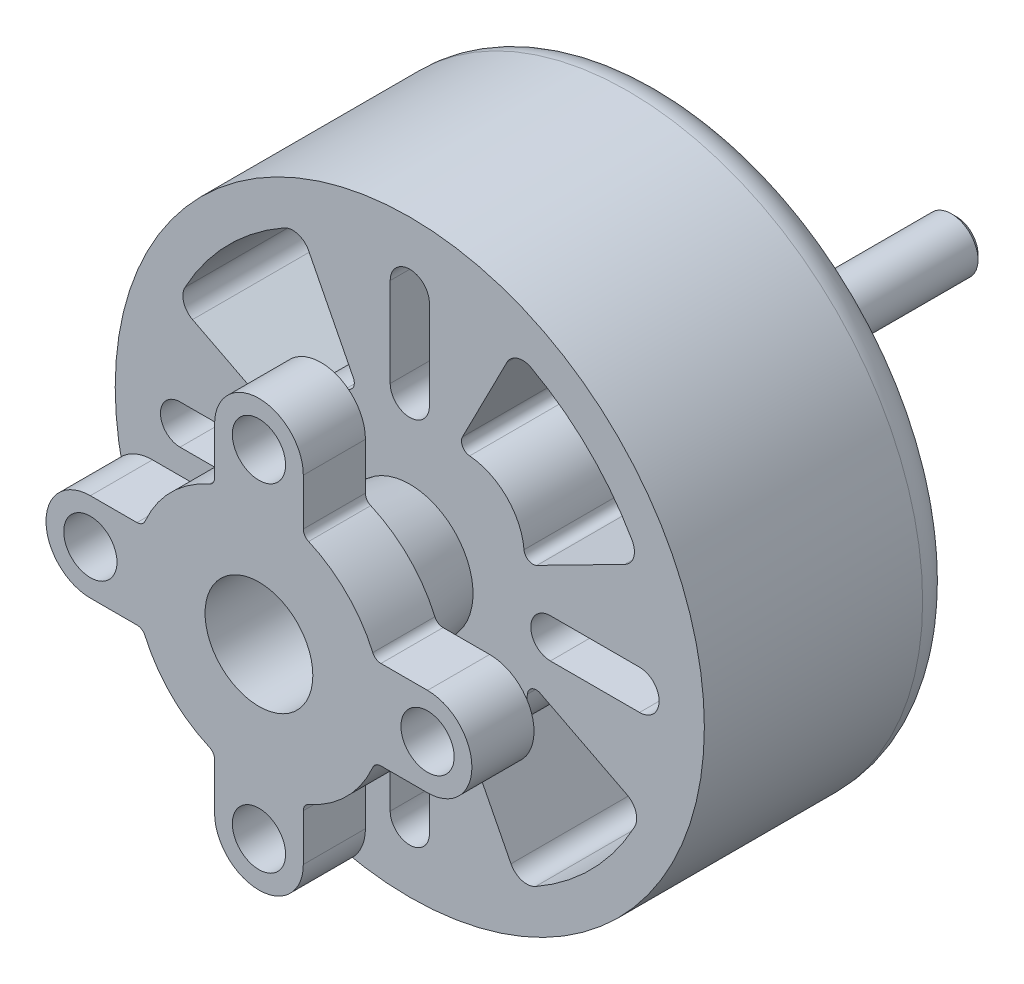
from build123d import *

# Parameters (mm, degrees)
IZIM1_R                     = 1.5
Y_KSEKLIK_EKSTR_ZYON1_DEPTH = 3.5
IZIM2_R                     = 4.444696269
Y_KSEKLIK_EKSTR_ZYON2_DEPTH = 5
Y_KSEKLIK_EKSTR_ZYON2_TAPER = 10
IZIM3_R                     = 16.6
Y_KSEKLIK_EKSTR_ZYON3_DEPTH = 14.3
IZIM4_R                     = 5.930506141
Y_KSEKLIK_EKSTR_ZYON4_DEPTH = 1
RADYUS1_R                   = 2
IZIM5_R                     = 2.5
Y_KSEKLIK_EKSTR_ZYON5_DEPTH = 15.5
IZIM7_R                     = 3.036237063
KES_EKSTR_ZYON1_DEPTH       = 15.5
KES_EKSTR_ZYON2_DEPTH       = 15.5
KES_EKSTR_ZYON3_DEPTH       = 14.3


# Read off the part's stored shape, not the designer's step: M3x0.5 Makine Dişleri Saplama1
with BuildPart() as part:
    # Çizim1 → Yükseklik-Ekstrüzyon1 (new body)
    with BuildSketch(Plane.XY):
        with BuildLine():
            Line((-6.873863542, 2.5), (-9.5, 2.5))
            ThreePointArc((-9.5, 2.5), (-12, 0), (-9.5, -2.5))
            Line((-9.5, -2.5), (-6.873863542, -2.5))
            ThreePointArc((-6.873863542, -2.5), (-6.600002264, -2.581669987), (-6.415605973, -2.8))
            ThreePointArc((-6.415605973, -2.8), (-4.949747468, -4.949747468), (-2.8, -6.415605973))
            ThreePointArc((-2.8, -6.415605973), (-2.581669987, -6.600002264), (-2.5, -6.873863542))
            Line((-2.5, -6.873863542), (-2.5, -9.5))
            ThreePointArc((-2.5, -9.5), (0, -12), (2.5, -9.5))
            Line((2.5, -9.5), (2.5, -6.873863542))
            ThreePointArc((2.5, -6.873863542), (2.581669987, -6.600002264), (2.8, -6.415605973))
            ThreePointArc((2.8, -6.415605973), (4.949747468, -4.949747468), (6.415605973, -2.8))
            ThreePointArc((6.415605973, -2.8), (6.600002264, -2.581669987), (6.873863542, -2.5))
            Line((6.873863542, -2.5), (9.5, -2.5))
            ThreePointArc((9.5, -2.5), (12, 0), (9.5, 2.5))
            Line((9.5, 2.5), (6.873863542, 2.5))
            ThreePointArc((6.873863542, 2.5), (6.600002264, 2.581669987), (6.415605973, 2.8))
            ThreePointArc((6.415605973, 2.8), (4.949747468, 4.949747468), (2.8, 6.415605973))
            ThreePointArc((2.8, 6.415605973), (2.581669987, 6.600002264), (2.5, 6.873863542))
            Line((2.5, 6.873863542), (2.5, 9.5))
            ThreePointArc((2.5, 9.5), (0, 12), (-2.5, 9.5))
            Line((-2.5, 9.5), (-2.5, 6.873863542))
            ThreePointArc((-2.5, 6.873863542), (-2.581669987, 6.600002264), (-2.8, 6.415605973))
            ThreePointArc((-2.8, 6.415605973), (-4.949747468, 4.949747468), (-6.415605973, 2.8))
            ThreePointArc((-6.415605973, 2.8), (-6.600002264, 2.581669987), (-6.873863542, 2.5))
        make_face()
        with Locations((0, -9.5)):
            Circle(IZIM1_R, mode=Mode.SUBTRACT)
        with Locations((9.5, 0)):
            Circle(IZIM1_R, mode=Mode.SUBTRACT)
        with Locations((-9.5, 0)):
            Circle(IZIM1_R, mode=Mode.SUBTRACT)
        with Locations((0, 9.5)):
            Circle(IZIM1_R, mode=Mode.SUBTRACT)
    extrude(amount=Y_KSEKLIK_EKSTR_ZYON1_DEPTH)

    # Çizim2 → Yükseklik-Ekstrüzyon2 (add)
    with BuildSketch(Plane(origin=(0, 0, 0), x_dir=(-1, 0, 0), z_dir=(0, 0, -1))):
        Circle(IZIM2_R)
    extrude(amount=Y_KSEKLIK_EKSTR_ZYON2_DEPTH, taper=Y_KSEKLIK_EKSTR_ZYON2_TAPER)

    # Çizim3 → Yükseklik-Ekstrüzyon3 (add)
    with BuildSketch(Plane(origin=(0, 0, -5), x_dir=(-1, 0, 0), z_dir=(0, 0, -1))):
        Circle(IZIM3_R)
    extrude(amount=Y_KSEKLIK_EKSTR_ZYON3_DEPTH)

    # Çizim4 → Yükseklik-Ekstrüzyon4 (add)
    with BuildSketch(Plane(origin=(0, 0, -19.3), x_dir=(-1, 0, 0), z_dir=(0, 0, -1))):
        Circle(IZIM4_R)
    extrude(amount=Y_KSEKLIK_EKSTR_ZYON4_DEPTH)

    # Radyus1
    radyus1_edges = [part.edges().sort_by_distance(p)[0] for p in [
        (16.6, 0, -19.3),
    ]]
    fillet(radyus1_edges, radius=RADYUS1_R)

    # Çizim5 → Yükseklik-Ekstrüzyon5 (add)
    with BuildSketch(Plane(origin=(0, 0, -20.3), x_dir=(-1, 0, 0), z_dir=(0, 0, -1))):
        Circle(IZIM5_R)
    extrude(amount=Y_KSEKLIK_EKSTR_ZYON5_DEPTH)

    # M3x0.5 Makine Dişleri Saplama1 outline → M3x0.5 Makine Dişleri Saplama1 (revolve, cut)
    with BuildSketch(Plane.XZ):
        Polygon((1.2195, -35.8), (2.5, -35.8), (2.5, -26.8), (1.5, -26.8), (1.5, -35.5195), align=None)
    revolve(axis=Axis((0, 0, 0), (0, 0, 1)), mode=Mode.SUBTRACT)

    # Çizim7 → Kes-Ekstrüzyon1 (cut)
    with BuildSketch(Plane.XY.offset(3.5)):
        Circle(IZIM7_R)
    extrude(amount=-KES_EKSTR_ZYON1_DEPTH, mode=Mode.SUBTRACT)

    # Çizim8 → Kes-Ekstrüzyon2 (cut)
    with BuildSketch(Plane.XY.offset(-5)):
        with BuildLine():
            Line((-7.354310006, 2.968244823), (-12.242132216, 5.473202633))
            ThreePointArc((-12.242132216, 5.473202633), (-12.741065417, 6.0665874), (-12.665995596, 6.838211883))
            ThreePointArc((-12.665995596, 6.838211883), (-10.277751926, 10.077519613), (-7.086052208, 12.529024315))
            ThreePointArc((-7.086052208, 12.529024315), (-6.305492258, 12.616142663), (-5.702755207, 12.112583838))
            Line((-5.702755207, 12.112583838), (-3.180498361, 7.162376053))
            ThreePointArc((-3.180498361, 7.162376053), (-3.188489381, 6.693341471), (-3.581591444, 6.437356972))
            ThreePointArc((-3.581591444, 6.437356972), (-5.663906626, 5.460279376), (-6.627977149, 3.371910354))
            ThreePointArc((-6.627977149, 3.371910354), (-6.883379112, 2.976172324), (-7.354310006, 2.968244823))
        make_face()
        with BuildLine():
            Line((2.968244823, 7.354310006), (5.473202633, 12.242132216))
            ThreePointArc((5.473202633, 12.242132216), (6.0665874, 12.741065417), (6.838211883, 12.665995596))
            ThreePointArc((6.838211883, 12.665995596), (10.077519613, 10.277751926), (12.529024315, 7.086052208))
            ThreePointArc((12.529024315, 7.086052208), (12.616142663, 6.305492258), (12.112583838, 5.702755207))
            Line((12.112583838, 5.702755207), (7.162376053, 3.180498361))
            ThreePointArc((7.162376053, 3.180498361), (6.693341471, 3.188489381), (6.437356972, 3.581591444))
            ThreePointArc((6.437356972, 3.581591444), (5.460279376, 5.663906626), (3.371910354, 6.627977149))
            ThreePointArc((3.371910354, 6.627977149), (2.976172324, 6.883379112), (2.968244823, 7.354310006))
        make_face()
        with BuildLine():
            Line((7.354310006, -2.968244823), (12.242132216, -5.473202633))
            ThreePointArc((12.242132216, -5.473202633), (12.741065417, -6.0665874), (12.665995596, -6.838211883))
            ThreePointArc((12.665995596, -6.838211883), (10.277751926, -10.077519613), (7.086052208, -12.529024315))
            ThreePointArc((7.086052208, -12.529024315), (6.305492258, -12.616142663), (5.702755207, -12.112583838))
            Line((5.702755207, -12.112583838), (3.180498361, -7.162376053))
            ThreePointArc((3.180498361, -7.162376053), (3.188489381, -6.693341471), (3.581591444, -6.437356972))
            ThreePointArc((3.581591444, -6.437356972), (5.663906626, -5.460279376), (6.627977149, -3.371910354))
            ThreePointArc((6.627977149, -3.371910354), (6.883379112, -2.976172324), (7.354310006, -2.968244823))
        make_face()
        with BuildLine():
            Line((-2.968244823, -7.354310006), (-5.473202633, -12.242132216))
            ThreePointArc((-5.473202633, -12.242132216), (-6.0665874, -12.741065417), (-6.838211883, -12.665995596))
            ThreePointArc((-6.838211883, -12.665995596), (-10.077519613, -10.277751926), (-12.529024315, -7.086052208))
            ThreePointArc((-12.529024315, -7.086052208), (-12.616142663, -6.305492258), (-12.112583838, -5.702755207))
            Line((-12.112583838, -5.702755207), (-7.162376053, -3.180498361))
            ThreePointArc((-7.162376053, -3.180498361), (-6.693341471, -3.188489381), (-6.437356972, -3.581591444))
            ThreePointArc((-6.437356972, -3.581591444), (-5.460279376, -5.663906626), (-3.371910354, -6.627977149))
            ThreePointArc((-3.371910354, -6.627977149), (-2.976172324, -6.883379112), (-2.968244823, -7.354310006))
        make_face()
    extrude(amount=-KES_EKSTR_ZYON2_DEPTH, mode=Mode.SUBTRACT)

    # Çizim9 → Kes-Ekstrüzyon3 (cut)
    with BuildSketch(Plane(origin=(0, 0, -19.3), x_dir=(-1, 0, 0), z_dir=(0, 0, -1))):
        with BuildLine():
            Line((-1.104517159, 7.922084558), (-1.104517159, 12.946929574))
            ThreePointArc((-1.104517159, 12.946929574), (0, 14.051446732), (1.104517159, 12.946929574))
            Line((1.104517159, 12.946929574), (1.104517159, 7.922084558))
            ThreePointArc((1.104517159, 7.922084558), (0, 6.8175674), (-1.104517159, 7.922084558))
        make_face()
        with BuildLine():
            Line((7.922084558, -1.104517159), (12.946929574, -1.104517159))
            ThreePointArc((12.946929574, -1.104517159), (14.051446732, 0), (12.946929574, 1.104517159))
            Line((12.946929574, 1.104517159), (7.922084558, 1.104517159))
            ThreePointArc((7.922084558, 1.104517159), (6.8175674, 0), (7.922084558, -1.104517159))
        make_face()
        with BuildLine():
            Line((-1.104517159, -7.922084558), (-1.104517159, -12.946929574))
            ThreePointArc((-1.104517159, -12.946929574), (0, -14.051446732), (1.104517159, -12.946929574))
            Line((1.104517159, -12.946929574), (1.104517159, -7.922084558))
            ThreePointArc((1.104517159, -7.922084558), (0, -6.8175674), (-1.104517159, -7.922084558))
        make_face()
        with BuildLine():
            Line((-7.922084558, 1.104517159), (-12.946929574, 1.104517159))
            ThreePointArc((-12.946929574, 1.104517159), (-14.051446732, 0), (-12.946929574, -1.104517159))
            Line((-12.946929574, -1.104517159), (-7.922084558, -1.104517159))
            ThreePointArc((-7.922084558, -1.104517159), (-6.8175674, 0), (-7.922084558, 1.104517159))
        make_face()
    extrude(amount=-KES_EKSTR_ZYON3_DEPTH, mode=Mode.SUBTRACT)


solid = part.part
